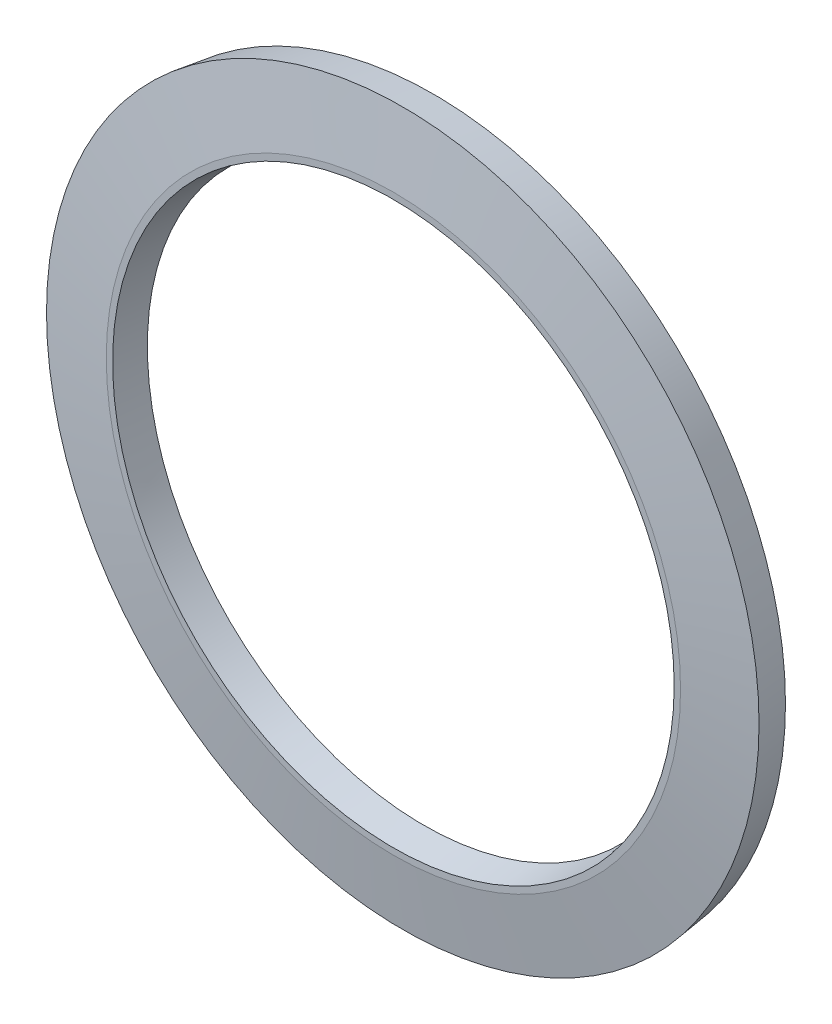
from build123d import *


with BuildPart() as part:
    # Sketch1 → Revolve1 (revolve)
    with BuildSketch(Plane(origin=(0, 0, 0), x_dir=(0, 0, -1), z_dir=(1, 0, 0))):
        Polygon((1.478675638, 56.15), (6.3, 55.495688442), (6.3, 54.495688442), (4.821324362, 43.6), (0, 44.254311558), (0, 45.254311558), align=None)
    revolve(axis=Axis((0, 0, 0), (0, 0, -1)))


solid = part.part
